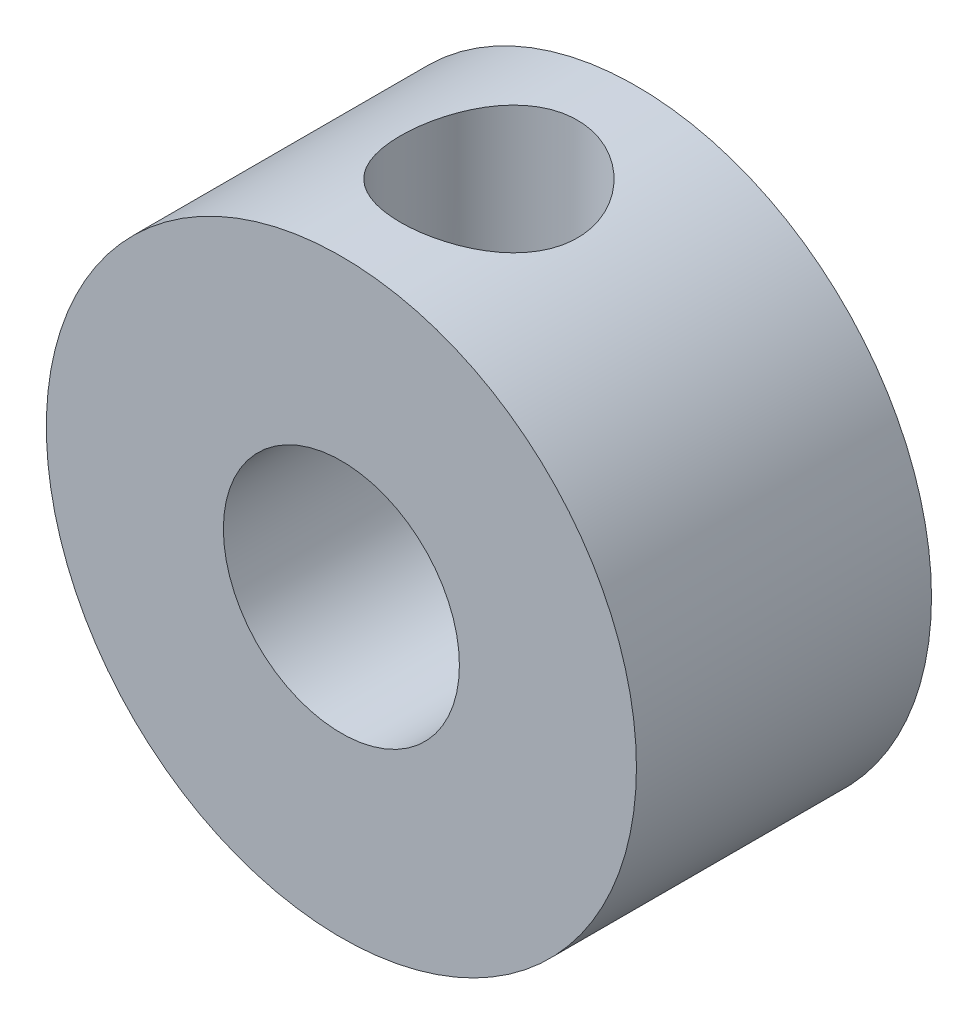
from build123d import *

# Parameters (mm, degrees)
SKETCH1_R           = 5
SKETCH1_R_2         = 2
BOSS_EXTRUDE1_DEPTH = 2.5
SKETCH3_R           = 1.5
CUT_EXTRUDE1_DEPTH  = 5


with BuildPart() as part:
    # Sketch1 → Boss-Extrude1 (new, symmetric)
    with BuildSketch(Plane.XY):
        Circle(SKETCH1_R)
        Circle(SKETCH1_R_2, mode=Mode.SUBTRACT)
    extrude(amount=BOSS_EXTRUDE1_DEPTH, both=True)

    # Sketch3 → Cut-Extrude1 (cut)
    with BuildSketch(Plane(origin=(0, 5, 0), x_dir=(1, 0, 0), z_dir=(0, 1, 0))):
        Circle(SKETCH3_R)
    extrude(amount=-CUT_EXTRUDE1_DEPTH, mode=Mode.SUBTRACT)


solid = part.part
